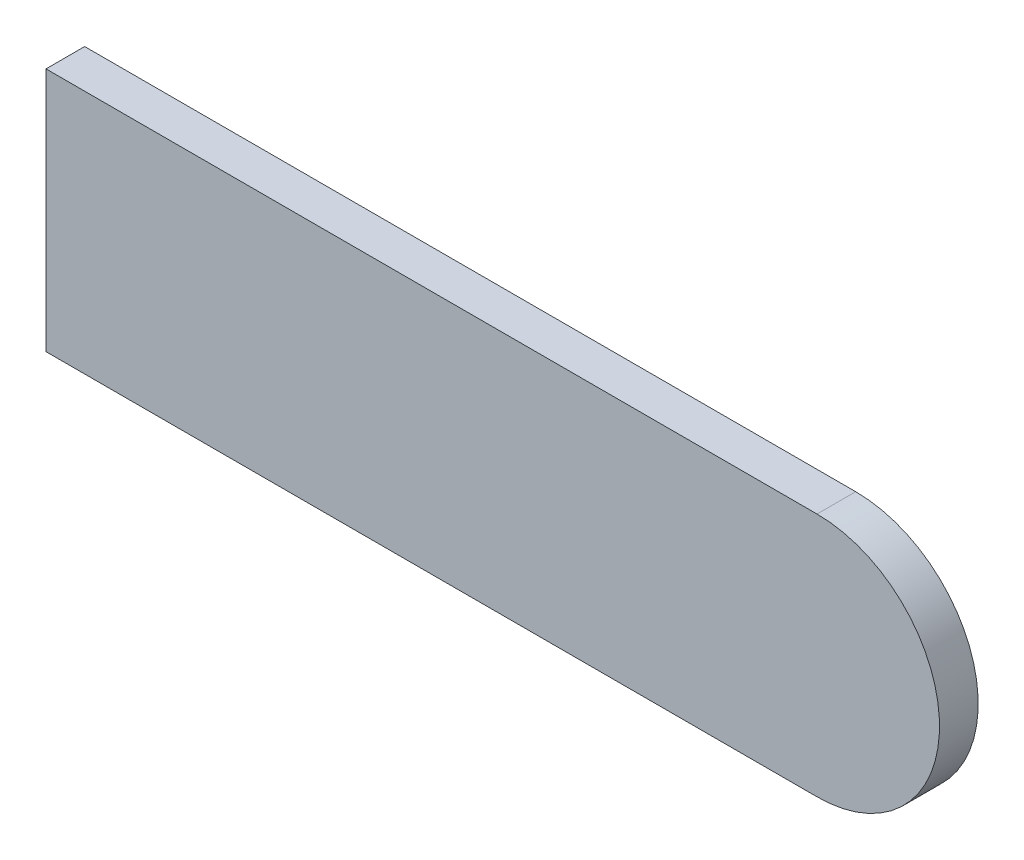
from build123d import *

# Parameters (mm, degrees)
BOSS_EXTRUDE1_DEPTH = 3


with BuildPart() as part:
    # Sketch1 → Boss-Extrude1 (new body)
    with BuildSketch(Plane.XY):
        with BuildLine():
            Line((-59.810556013, -9.5), (0, -9.5))
            ThreePointArc((0, -9.5), (9.5, 0), (0, 9.5))
            Line((0, 9.5), (-59.810556013, 9.5))
            Line((-59.810556013, 9.5), (-59.810556013, -9.5))
        make_face()
    extrude(amount=BOSS_EXTRUDE1_DEPTH)


solid = part.part
